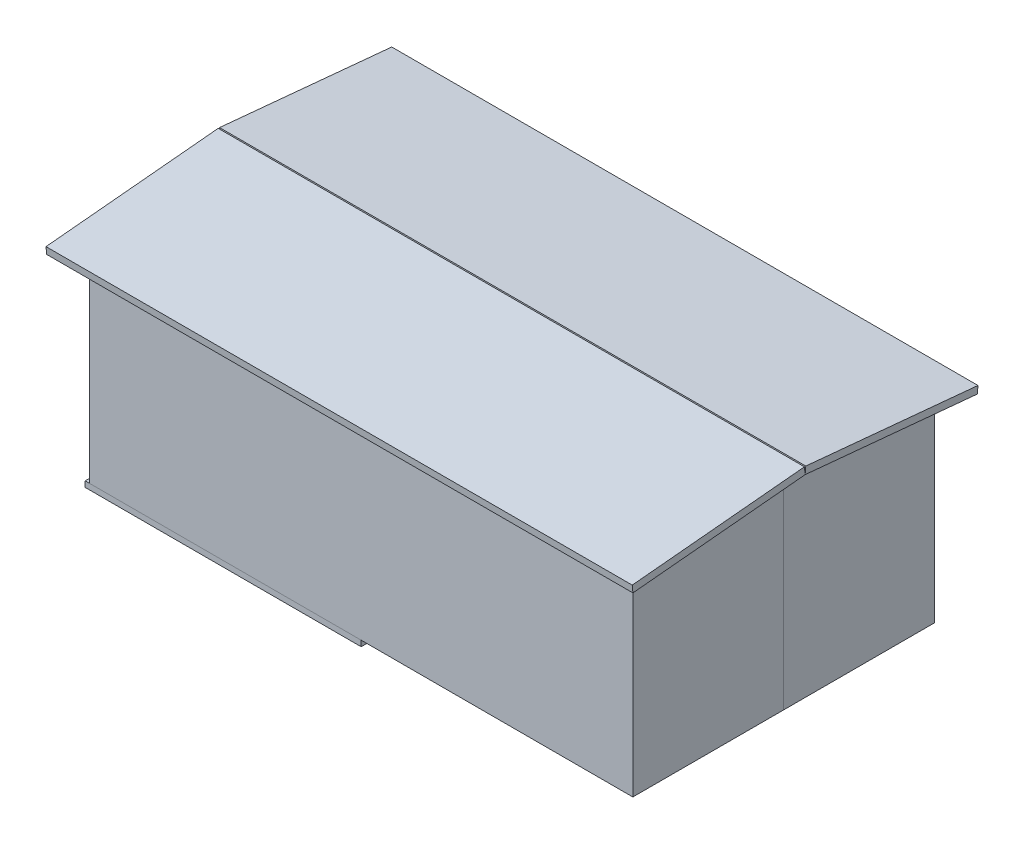
from build123d import *

# Parameters (mm, degrees)
METAL_FRAME_W       = 7720
METAL_FRAME_H       = 4220
METAL_FRAME_W_2     = 7600
METAL_FRAME_H_2     = 2020
METALFRAME_DEPTH    = 80
SKETCH18_W          = 4667.943298929
SKETCH18_H          = 6508.190176391
CUT_EXTRUDE1_DEPTH  = 8718.086669295
SKETCH19_W          = 60
SKETCH19_H          = 4100
BOSS_EXTRUDE1_DEPTH = 80
BOSS_EXTRUDE3_DEPTH = 7600
SKETCH22_W          = 8200
SKETCH22_H          = 2419.457477752
BOSS_EXTRUDE4_DEPTH = 100


with BuildPart() as part:
    # Metal frame → MetalFrame (new body)
    with BuildSketch(Plane(origin=(0, 0, 0), x_dir=(1, 0, 0), z_dir=(0, 1, 0))):
        with Locations((3800, 2050)):
            Rectangle(METAL_FRAME_W, METAL_FRAME_H)
        with Locations((3800, 1010)):
            Rectangle(METAL_FRAME_W_2, METAL_FRAME_H_2, mode=Mode.SUBTRACT)
        with Locations((3800, 3090)):
            Rectangle(METAL_FRAME_W_2, METAL_FRAME_H_2, mode=Mode.SUBTRACT)
    extrude(amount=-METALFRAME_DEPTH)

    # Sketch18 → Cut-Extrude1 (cut, through all)
    with BuildSketch(Plane(origin=(0, 0, 0), x_dir=(1, 0, 0), z_dir=(0, 1, 0))):
        with Locations((6133.971649464, 2239.218210402)):
            Rectangle(SKETCH18_W, SKETCH18_H)
    extrude(amount=-CUT_EXTRUDE1_DEPTH, mode=Mode.SUBTRACT)

    # Sketch19 → Boss-Extrude1 (add)
    with BuildSketch(Plane(origin=(0, 0, 0), x_dir=(1, 0, 0), z_dir=(0, 1, 0))):
        with Locations((3770, 2050)):
            Rectangle(SKETCH19_W, SKETCH19_H)
    extrude(amount=-BOSS_EXTRUDE1_DEPTH)


with BuildPart() as body_2:
    # Sketch21 → Boss-Extrude3 (new body)
    with BuildSketch(Plane(origin=(0, 0, 0), x_dir=(0, 0, -1), z_dir=(1, 0, 0))):
        Polygon((2050, 0), (4160, 0), (4160, 2800), (2050, 3000), align=None)
    extrude(amount=BOSS_EXTRUDE3_DEPTH)


with BuildPart() as body_3:
    # Sketch22 → Boss-Extrude4 (new body)
    with BuildSketch(Plane(origin=(0, 3165.86896997, -300.082366822), x_dir=(1, 0, 0), z_dir=(0, 0.9955377836774076, -0.0943637709646831))):
        with Locations((3800, 2967.489882521)):
            Rectangle(SKETCH22_W, SKETCH22_H)
    extrude(amount=BOSS_EXTRUDE4_DEPTH)


with BuildPart() as body_4:
    # Mirror1: mirrored copy
    add(body_3.part.mirror(Plane(origin=(7600, 3000, -2050), x_dir=(1, 0, 0), z_dir=(0, 0, -1))))


with BuildPart() as body_5:
    # Mirror1 2: mirrored copy
    add(body_2.part.mirror(Plane(origin=(7600, 3000, -2050), x_dir=(1, 0, 0), z_dir=(0, 0, -1))))


solid = Compound([part.part, body_2.part, body_3.part, body_4.part, body_5.part])
